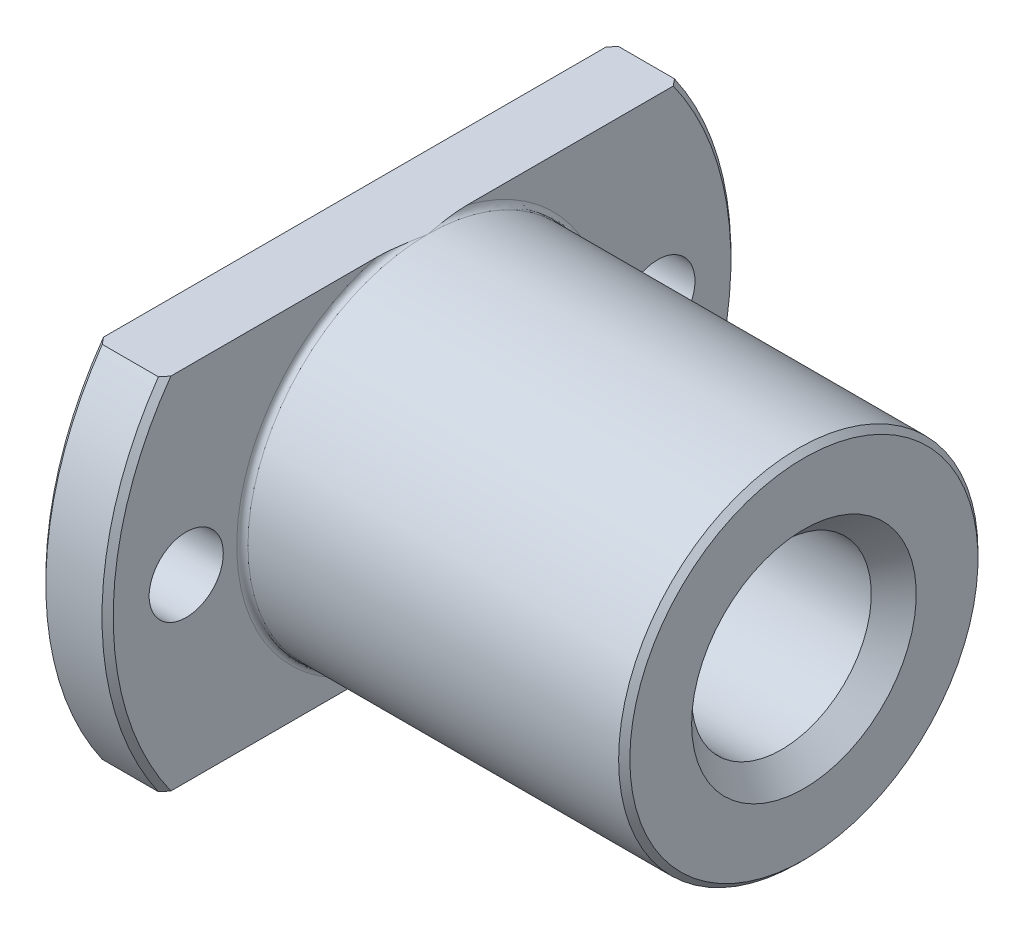
from build123d import *

# Parameters (mm, degrees)
SKETCH_3_R               = 3.3
CUT_EXTRUDE_1_DEPTH      = 6
SKETCH_4_R               = 3.3
CUT_EXTRUDE_2_DEPTH      = 6
SKETCH_5_R               = 3.3
CUT_EXTRUDE_3_DEPTH      = 6
SKETCH_6_R               = 3.3
CUT_EXTRUDE_4_DEPTH      = 6
CUT_EXTRUDE_5_DEPTH      = 42
CUT_EXTRUDE_5_DEPTH_BACK = 42
SKETCH_7_W               = 40
SKETCH_7_H               = 32
CUT_EXTRUDE_6_DEPTH      = 42
CUT_EXTRUDE_6_DEPTH_BACK = 42
SKETCH_8_W               = 40
SKETCH_8_H               = 32


with BuildPart() as part:
    # 草图1 → 旋转1 (revolve)
    with BuildSketch(Plane.XY):
        with BuildLine():
            Line((0, 0), (0, 27.5))
            Line((0, 27.5), (0.5, 28))
            Line((0.5, 28), (5.5, 28))
            Line((5.5, 28), (6, 27.5))
            Line((6, 27.5), (6, 16.5))
            ThreePointArc((6, 16.5), (6.146446609, 16.146446609), (6.5, 16))
            Line((6.5, 16), (39.5, 16))
            Line((39.5, 16), (40, 15.5))
            Line((40, 15.5), (40, 0))
            Line((40, 0), (0, 0))
        make_face()
    revolve(axis=Axis((40, 0, 0), (-1, 0, 0)))

    # 草图2 → 切除-旋转1 (revolve, cut)
    with BuildSketch(Plane.XY):
        Polygon((0, 0), (0, 10), (2, 8), (38, 8), (40, 10), (40, 0), align=None)
    revolve(axis=Axis((40, 0, 0), (-1, 0, 0)), mode=Mode.SUBTRACT)

    # 草图3 → 切除-拉伸1 (cut)
    with BuildSketch(Plane(origin=(0, 0, 0), x_dir=(0, 0, -1), z_dir=(1, 0, 0))):
        with Locations((21, 0)):
            Circle(SKETCH_3_R)
    extrude(amount=CUT_EXTRUDE_1_DEPTH, mode=Mode.SUBTRACT)

    # 草图4 → 切除-拉伸2 (cut)
    with BuildSketch(Plane(origin=(0, 0, 0), x_dir=(0, 0, -1), z_dir=(1, 0, 0))):
        with Locations((-21, 0)):
            Circle(SKETCH_4_R)
    extrude(amount=CUT_EXTRUDE_2_DEPTH, mode=Mode.SUBTRACT)

    # 草图5 → 切除-拉伸3 (cut)
    with BuildSketch(Plane(origin=(0, 0, 0), x_dir=(0, 0, -1), z_dir=(1, 0, 0))):
        with Locations((0, 21)):
            Circle(SKETCH_5_R)
    extrude(amount=CUT_EXTRUDE_3_DEPTH, mode=Mode.SUBTRACT)

    # 草图6 → 切除-拉伸4 (cut)
    with BuildSketch(Plane(origin=(0, 0, 0), x_dir=(0, 0, -1), z_dir=(1, 0, 0))):
        with Locations((0, -21)):
            Circle(SKETCH_6_R)
    extrude(amount=CUT_EXTRUDE_4_DEPTH, mode=Mode.SUBTRACT)

    # 草图7 → 切除-拉伸5 (cut, two sides: drawn at the far end of the back side and taken through both)
    with BuildSketch(Plane.XY.offset(-CUT_EXTRUDE_5_DEPTH_BACK)):
        with Locations((20, 32)):
            Rectangle(SKETCH_7_W, SKETCH_7_H)
    extrude(amount=CUT_EXTRUDE_5_DEPTH + CUT_EXTRUDE_5_DEPTH_BACK, mode=Mode.SUBTRACT)

    # 草图8 → 切除-拉伸6 (cut, two sides: drawn at the far end of the back side and taken through both)
    with BuildSketch(Plane.XY.offset(-CUT_EXTRUDE_6_DEPTH_BACK)):
        with Locations((20, -32)):
            Rectangle(SKETCH_8_W, SKETCH_8_H)
    extrude(amount=CUT_EXTRUDE_6_DEPTH + CUT_EXTRUDE_6_DEPTH_BACK, mode=Mode.SUBTRACT)


solid = part.part
